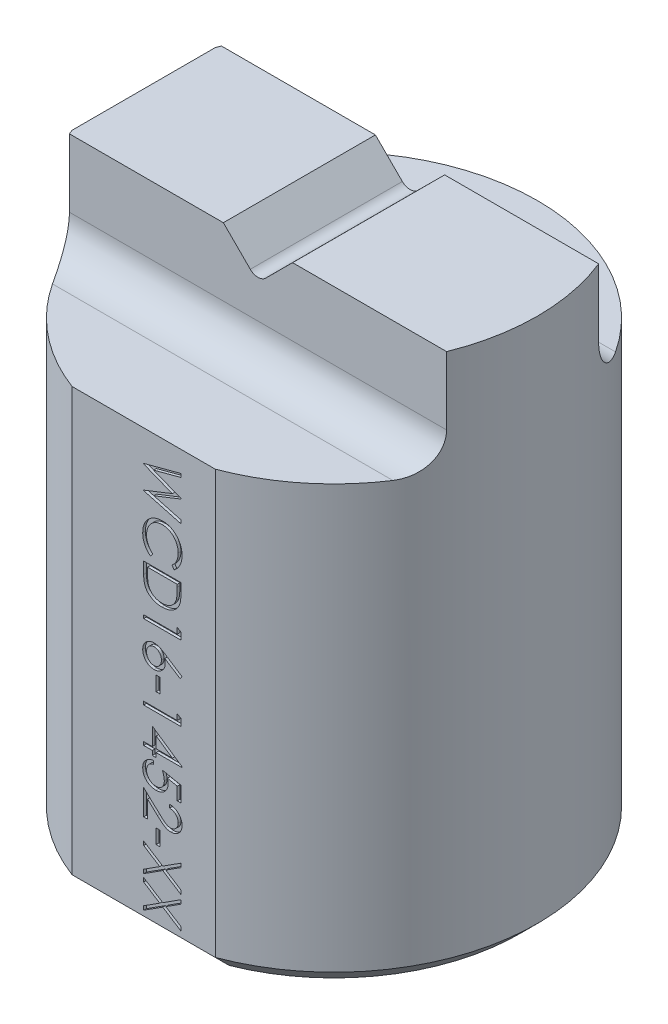
from build123d import *

# Parameters (mm, degrees)
CROQUIS1_R                 = 19.0246
SALIENTE_EXTRUIR1_DEPTH    = 50.8
CORTAR_EXTRUIR5_DEPTH      = 50.8
CORTAR_EXTRUIR5_DEPTH_BACK = 50.8
CORTAR_EXTRUIR7_DEPTH      = 50.8
CORTAR_EXTRUIR7_DEPTH_BACK = 50.8
CORTAR_EXTRUIR4_START      = -50.8
CORTAR_EXTRUIR4_DEPTH      = 50.8
CHAFL_N1_SIZE              = 1.5875
CROQUIS16_W                = 0.358974359
CROQUIS16_H                = 1.346153846
CORTAR_EXTRUIR8_DEPTH      = 0.254


with BuildPart() as part:
    # Croquis1 → Saliente-Extruir1 (new body)
    with BuildSketch(Plane(origin=(0, 0, 0), x_dir=(1, 0, 0), z_dir=(0, 1, 0))):
        with Locations(Location((0, 0, 0), (0, 0, 270))):
            Circle(CROQUIS1_R)
    extrude(amount=SALIENTE_EXTRUIR1_DEPTH)

    # Croquis12 → Cortar-Extruir5 (cut, two sides: drawn at the far end of the back side and taken through both)
    with BuildSketch(Plane(origin=(0, 0, 0), x_dir=(0, 0, -1), z_dir=(1, 0, 0)).offset(-CORTAR_EXTRUIR5_DEPTH_BACK)):
        with BuildLine():
            Line((7.112, 50.8), (19.0246, 50.8))
            Line((19.0246, 50.8), (19.0246, 41.148))
            Line((19.0246, 41.148), (10.414, 41.148))
            ThreePointArc((10.414, 41.148), (8.079133409, 42.115133409), (7.112, 44.45))
            Line((7.112, 44.45), (7.112, 50.8))
        make_face()
        with BuildLine():
            Line((-7.112, 50.8), (-19.0246, 50.8))
            Line((-19.0246, 50.8), (-19.0246, 41.148))
            Line((-19.0246, 41.148), (-10.414, 41.148))
            ThreePointArc((-10.414, 41.148), (-8.079133409, 42.115133409), (-7.112, 44.45))
            Line((-7.112, 44.45), (-7.112, 50.8))
        make_face()
    extrude(amount=CORTAR_EXTRUIR5_DEPTH + CORTAR_EXTRUIR5_DEPTH_BACK, mode=Mode.SUBTRACT)

    # Croquis14 → Cortar-Extruir7 (cut, two sides: drawn at the far end of the back side and taken through both)
    with BuildSketch(Plane.XY.offset(-CORTAR_EXTRUIR7_DEPTH_BACK)):
        with BuildLine():
            Line((-3.2385, 50.8), (-0.717176471, 48.287385732))
            ThreePointArc((-0.717176471, 48.287385732), (0, 47.99104809), (0.717176471, 48.287385732))
            Line((0.717176471, 48.287385732), (3.2385, 50.8))
            Line((3.2385, 50.8), (-3.2385, 50.8))
        make_face()
    extrude(amount=CORTAR_EXTRUIR7_DEPTH + CORTAR_EXTRUIR7_DEPTH_BACK, mode=Mode.SUBTRACT)

    # Croquis11 → Cortar-Extruir4 (cut)
    with BuildSketch(Plane(origin=(0, 50.8, 0), x_dir=(1, 0, 0), z_dir=(0, 1, 0)).offset(CORTAR_EXTRUIR4_START)):
        with BuildLine():
            Line((-17.8054, 0), (-17.8054, 6.700980227))
            ThreePointArc((-17.8054, 6.700980227), (-19.0246, 0), (-17.8054, -6.700980227))
            Line((-17.8054, -6.700980227), (-17.8054, 0))
        make_face()
        with BuildLine():
            Line((0, -17.8054), (-6.700980227, -17.8054))
            ThreePointArc((-6.700980227, -17.8054), (0, -19.0246), (6.700980227, -17.8054))
            Line((6.700980227, -17.8054), (0, -17.8054))
        make_face()
    extrude(amount=CORTAR_EXTRUIR4_DEPTH, mode=Mode.SUBTRACT)

    # Chaflán1
    # the kernel refuses this chamfer: 1.5875 mm, written as the material it takes off along each edge
    with BuildSketch(Plane(origin=(10.78352697, 0, 17.8054), x_dir=(0, 0.9996219169112966, 0.027495876610585654), z_dir=(-1, 0, 0)), Plane(origin=(-17.8054, 0, 10.78352697), x_dir=(-0.027495876610585654, 0.9996219169112966, 0), z_dir=(0, 0, -1))) as chafl_n1_piece_1:
        Polygon((CHAFL_N1_SIZE * 0.999621916911, CHAFL_N1_SIZE * 0.0274958766106), (-CHAFL_N1_SIZE * 0.0274958766106, CHAFL_N1_SIZE * 0.999621916911), (0, 0), align=None)
    extrude(amount=21.56705394, mode=Mode.SUBTRACT)
    with BuildSketch(Plane(origin=(0, 0, 0), x_dir=(0.14429341464634798, 0, 0.9895349465732359), z_dir=(-0.9895349465732359, 0, 0.14429341464634798))) as chafl_n1_piece_2:
        Polygon((19.0246 - CHAFL_N1_SIZE, 0), (19.0246, CHAFL_N1_SIZE), (19.0246, 0), align=None)
    revolve(axis=Axis((0, 0, 0), (0, 1, 0)), revolution_arc=253.40727091, mode=Mode.SUBTRACT)
    with BuildSketch(Plane(origin=(0, 0, 0), x_dir=(-0.9894579755550961, 0, 0.14482028383624634), z_dir=(-0.14482028383624634, 0, -0.9894579755550961))) as chafl_n1_piece_3:
        Polygon((19.0246, CHAFL_N1_SIZE), (19.0246 - CHAFL_N1_SIZE, 0), (19.0246, 0), align=None)
    revolve(axis=Axis((0, 0, 0), (0, 1, 0)), revolution_arc=73.346255269, mode=Mode.SUBTRACT)

    # Croquis16 → Cortar-Extruir8 (cut)
    # profile 1 of 13: a face of its own
    with BuildSketch(Plane.XY.offset(17.8054)):
        Polygon((3.5, 4.666948718), (3.5, 4.30446875), (2.069010417, 3.388803686), (3.5, 2.473839744), (3.5, 2.10925641), (1.78505609, 3.206512019), (0, 2.064384615), (0, 2.426864583), (1.501802885, 3.388102564), (0, 4.348639423), (0, 4.711820513), (1.785757212, 3.569693109), align=None)
    # profile 2 of 13: a face of its own
    with BuildSketch(Plane.XY.offset(17.8054)):
        Polygon((3.5, 7.628487179), (3.5, 7.266007212), (2.069010417, 6.350342147), (3.5, 5.435378205), (3.5, 5.070794872), (1.78505609, 6.168050481), (0, 5.025923077), (0, 5.388403045), (1.501802885, 6.349641026), (0, 7.310177885), (0, 7.673358974), (1.785757212, 6.531231571), align=None)
    # profile 3 of 13: a face of its own
    with BuildSketch(Plane.XY.offset(17.8054)):
        with Locations((1.346153847, 8.638102564)):
            Rectangle(CROQUIS16_W, CROQUIS16_H)
    # profile 4 of 13: a face of its own
    with BuildSketch(Plane.XY.offset(17.8054)):
        with BuildLine():
            Line((2.423076923, 11.554769231), (2.423076923, 11.868871795))
            add(Edge.make_bspline(
                [(2.423076923, 11.868871795), (2.464748016, 11.86682499), (2.546588934, 11.862805121), (2.665909934, 11.843971901), (2.779975252, 11.817048868), (2.887806988, 11.778892651), (2.990693283, 11.731773056), (3.087267925, 11.674085036), (3.178489406, 11.607058407), (3.262630601, 11.53081613), (3.339546174, 11.448086233), (3.406669589, 11.359364397), (3.46273344, 11.265562514), (3.5098564, 11.167494181), (3.545184955, 11.06402521), (3.571409677, 10.956144647), (3.587185182, 10.843364885), (3.588881084, 10.766524949), (3.58974359, 10.727445513)],
                knots=[0, 0, 0, 0, 1.100776268, 2.161895295, 3.184016182, 4.190939212, 5.176500551, 6.166955529, 7.155448256, 8.160289653, 9.16017456, 10.133824356, 11.091467644, 12.04088621, 13.000931625, 13.972173743, 14.968683325, 16, 16, 16, 16], degree=3))
            add(Edge.make_bspline(
                [(3.58974359, 10.727445513), (3.588845133, 10.689067439), (3.587079698, 10.613655894), (3.571918669, 10.50359388), (3.548173078, 10.398816585), (3.514857661, 10.299528819), (3.470073234, 10.206522754), (3.416275695, 10.11909971), (3.354055864, 10.036218899), (3.28080205, 9.961612115), (3.202599666, 9.893104036), (3.119111762, 9.834001781), (3.032882477, 9.783388617), (2.943254275, 9.741200937), (2.849383247, 9.710144798), (2.752636044, 9.68656659), (2.652011233, 9.673239177), (2.583904677, 9.671193753), (2.549278846, 9.670153846)],
                knots=[0, 0, 0, 0, 1.111607364, 2.184268762, 3.212621178, 4.221274766, 5.211760367, 6.196651075, 7.1921475, 8.207485113, 9.220403448, 10.201281604, 11.166441695, 12.114753415, 13.065576456, 14.026450734, 14.996634279, 16, 16, 16, 16], degree=3))
            add(Edge.make_bspline(
                [(2.549278846, 9.670153846), (2.500531028, 9.671844829), (2.403890848, 9.67519712), (2.261657256, 9.703989144), (2.123960365, 9.748782887), (2.012708427, 9.80201516), (1.923621611, 9.856555617), (1.850138441, 9.905614056), (1.771037485, 9.963087935), (1.68655876, 10.029763645), (1.596048281, 10.104277374), (1.499558358, 10.18729928), (1.398086626, 10.279422838), (1.328781019, 10.344081328), (1.29286859, 10.377585737)],
                knots=[0, 0, 0, 0, 1.184136889, 2.347493852, 3.513608722, 4.697895552, 5.335178528, 6.052199267, 6.845488095, 7.711597353, 8.668264519, 9.695616787, 10.805926351, 12, 12, 12, 12], degree=3))
            Line((1.29286859, 10.377585737), (0.358974359, 11.253286859))
            Line((0.358974359, 11.253286859), (0.358974359, 9.625282051))
            Line((0.358974359, 9.625282051), (0, 9.625282051))
            Line((0, 9.625282051), (0, 12.003487179))
            Line((0, 12.003487179), (1.448517628, 10.646115385))
            add(Edge.make_bspline(
                [(1.448517628, 10.646115385), (1.483014053, 10.613065158), (1.549274626, 10.549582437), (1.646042341, 10.459830643), (1.735709677, 10.379089433), (1.818673971, 10.307305249), (1.894464892, 10.244419025), (1.963676397, 10.19063197), (2.025714532, 10.145706354), (2.098594339, 10.098094564), (2.187681869, 10.052693562), (2.296003864, 10.012790727), (2.407759457, 9.988634094), (2.483257707, 9.98572148), (2.521233974, 9.98425641)],
                knots=[0, 0, 0, 0, 1.329530082, 2.553755191, 3.672934919, 4.687409497, 5.60679272, 6.413407421, 7.126401618, 7.737995624, 8.834647426, 9.90044882, 10.943907757, 12, 12, 12, 12], degree=3))
            add(Edge.make_bspline(
                [(2.521233974, 9.98425641), (2.545118012, 9.984885622), (2.592188863, 9.986125678), (2.661156757, 9.997277074), (2.727942288, 10.013660688), (2.7917197, 10.038912898), (2.853743372, 10.069252499), (2.91212759, 10.108013576), (2.968862533, 10.152307309), (3.022002807, 10.203685867), (3.07068755, 10.260089976), (3.113810711, 10.319686161), (3.149850063, 10.38273576), (3.179393496, 10.448976018), (3.202568894, 10.51822145), (3.218627469, 10.590606205), (3.228709954, 10.665930219), (3.230074126, 10.717363715), (3.230769231, 10.743571314)],
                knots=[0, 0, 0, 0, 0.991504627, 1.954065223, 2.895985987, 3.842598665, 4.797835564, 5.759220273, 6.74786863, 7.784730864, 8.824135544, 9.839918996, 10.835834653, 11.835434876, 12.84861661, 13.863796685, 14.911511676, 16, 16, 16, 16], degree=3))
            add(Edge.make_bspline(
                [(3.230769231, 10.743571314), (3.230054415, 10.770942268), (3.228650634, 10.824694303), (3.218824902, 10.903611613), (3.201890229, 10.978903664), (3.178673151, 11.050722869), (3.149442666, 11.119138426), (3.112332364, 11.183531721), (3.068791169, 11.244490644), (3.019156583, 11.301903234), (2.963634417, 11.354656397), (2.902503649, 11.40198027), (2.835366634, 11.442342532), (2.763739792, 11.47812186), (2.685718657, 11.505498341), (2.603193858, 11.528899494), (2.514992916, 11.545898701), (2.454224465, 11.551763277), (2.423076923, 11.554769231)],
                knots=[0, 0, 0, 0, 1.031212865, 2.025131798, 2.990757446, 3.934781266, 4.865570067, 5.788494791, 6.729227313, 7.684356718, 8.643577152, 9.610526866, 10.590658432, 11.59095419, 12.621640561, 13.700587263, 14.82141059, 16, 16, 16, 16], degree=3))
        make_face()
    # profile 5 of 13: a face of its own
    with BuildSketch(Plane.XY.offset(17.8054)):
        with BuildLine():
            Line((3.5, 12.497076923), (3.141025641, 12.497076923))
            Line((3.141025641, 12.497076923), (3.141025641, 13.686880609))
            Line((3.141025641, 13.686880609), (2.220452724, 13.876183494))
            add(Edge.make_bspline(
                [(2.220452724, 13.876183494), (2.230682996, 13.839127619), (2.25050253, 13.767337723), (2.2725083, 13.661377862), (2.285773744, 13.560785659), (2.287585055, 13.495510289), (2.288461538, 13.463923878)],
                knots=[0, 0, 0, 0, 1.100273476, 2.13160584, 3.095893838, 4, 4, 4, 4], degree=3))
            add(Edge.make_bspline(
                [(2.288461538, 13.463923878), (2.287615381, 13.424840273), (2.285951625, 13.347992141), (2.269982922, 13.235551278), (2.244831581, 13.128225344), (2.20975253, 13.026197713), (2.16460626, 12.929248626), (2.108941852, 12.837919492), (2.043144334, 12.751692715), (1.967848539, 12.671708181), (1.884877575, 12.599258758), (1.795958621, 12.535307426), (1.701010796, 12.482120557), (1.600453954, 12.438362922), (1.494456815, 12.403645464), (1.382234792, 12.380474877), (1.264783752, 12.36506331), (1.184479588, 12.363340209), (1.143529647, 12.362461538)],
                knots=[0, 0, 0, 0, 1.052772836, 2.070014431, 3.053871312, 4.019926262, 4.972333346, 5.930471369, 6.896690565, 7.89035727, 8.885779078, 9.861050232, 10.836829716, 11.812751485, 12.812646763, 13.836748493, 14.896881366, 16, 16, 16, 16], degree=3))
            add(Edge.make_bspline(
                [(1.143529647, 12.362461538), (1.11500739, 12.363126524), (1.058348328, 12.364447509), (0.974204676, 12.37116741), (0.891839802, 12.38409824), (0.81125494, 12.401483994), (0.732557826, 12.423959989), (0.655777085, 12.451464292), (0.580676295, 12.483885086), (0.507250538, 12.520488929), (0.437763412, 12.562832793), (0.371142281, 12.607437111), (0.309838941, 12.656846418), (0.251615412, 12.708668561), (0.198758223, 12.764975694), (0.149005388, 12.824020133), (0.104518066, 12.887187505), (0.063599772, 12.953346878), (0.026963122, 13.022456533), (-0.003598389, 13.095217228), (-0.030385817, 13.170031676), (-0.052169495, 13.247566689), (-0.069070481, 13.327672058), (-0.080579823, 13.410623634), (-0.088953871, 13.496005178), (-0.089478555, 13.553880071), (-0.08974359, 13.583114583)],
                knots=[0, 0, 0, 0, 1.05623316, 2.098192244, 3.122504159, 4.140841222, 5.148757784, 6.150489607, 7.158294732, 8.176043417, 9.185147859, 10.169157858, 11.142149047, 12.097904048, 13.0527185, 13.998867679, 14.954465986, 15.910220987, 16.877849176, 17.847023716, 18.829548819, 19.818454515, 20.826519638, 21.858115382, 22.918063636, 24, 24, 24, 24], degree=3))
            add(Edge.make_bspline(
                [(-0.08974359, 13.583114583), (-0.089052691, 13.617988721), (-0.08769343, 13.686599468), (-0.073475808, 13.787120644), (-0.053108741, 13.883833027), (-0.02248395, 13.975971225), (0.015945705, 14.064312609), (0.064206634, 14.147681188), (0.119660638, 14.227715607), (0.184221067, 14.302240627), (0.255448024, 14.371268491), (0.331914473, 14.434008824), (0.413924458, 14.489031719), (0.500779798, 14.536561723), (0.592629943, 14.577045569), (0.689749741, 14.608864467), (0.791650622, 14.634541751), (0.861804012, 14.645405319), (0.897435897, 14.650923077)],
                knots=[0, 0, 0, 0, 1.046825758, 2.059506013, 3.044032586, 4.011925612, 4.970610144, 5.93275819, 6.900651216, 7.891265644, 8.889116719, 9.876966323, 10.858259055, 11.851035124, 12.847502422, 13.86866322, 14.9174643, 16, 16, 16, 16], degree=3))
            Line((0.897435897, 14.650923077), (0.897435897, 14.336820513))
            add(Edge.make_bspline(
                [(0.897435897, 14.336820513), (0.864056261, 14.329096819), (0.799898745, 14.314251452), (0.709809781, 14.281580974), (0.629226092, 14.241881547), (0.5580716, 14.193600698), (0.495697109, 14.137172103), (0.439632625, 14.073243352), (0.389723386, 14.000903697), (0.34785381, 13.920549253), (0.312197898, 13.835725533), (0.288442785, 13.746961156), (0.271742785, 13.656656069), (0.270070904, 13.595577798), (0.269230769, 13.564885417)],
                knots=[0, 0, 0, 0, 1.136389429, 2.184203582, 3.172920998, 4.111012962, 5.028380909, 5.957351669, 6.927793475, 7.937618031, 8.960409703, 9.974842029, 10.982339866, 12, 12, 12, 12], degree=3))
            add(Edge.make_bspline(
                [(0.269230769, 13.564885417), (0.270051547, 13.534926972), (0.271667666, 13.47593855), (0.284106678, 13.389127163), (0.303264249, 13.305314289), (0.331934104, 13.225326932), (0.366778822, 13.147765393), (0.411493898, 13.074591622), (0.462953917, 13.003688745), (0.521910547, 12.937260612), (0.586880241, 12.876421162), (0.656357635, 12.822665041), (0.730474481, 12.777888128), (0.807947634, 12.740154019), (0.889626191, 12.71150072), (0.975127366, 12.691059739), (1.064662347, 12.67905668), (1.125731656, 12.6774055), (1.156850962, 12.676564103)],
                knots=[0, 0, 0, 0, 1.027316725, 2.022795036, 3.002884548, 3.971462791, 4.93288096, 5.914575861, 6.907176829, 7.935150275, 8.956128384, 9.956726525, 10.942570165, 11.921478529, 12.907843606, 13.90538589, 14.932640048, 16, 16, 16, 16], degree=3))
            add(Edge.make_bspline(
                [(1.156850962, 12.676564103), (1.18494363, 12.677116522), (1.239962545, 12.678198425), (1.320101712, 12.690221023), (1.396479006, 12.707062818), (1.468411408, 12.732921244), (1.536952265, 12.764871524), (1.600634552, 12.805406609), (1.661094376, 12.851742387), (1.715875584, 12.906014398), (1.766777344, 12.96519572), (1.810106091, 13.03066015), (1.846574147, 13.100914496), (1.878041003, 13.175145636), (1.900642067, 13.255110105), (1.917609863, 13.339226858), (1.927425251, 13.428403533), (1.928787135, 13.489374225), (1.929487179, 13.520714744)],
                knots=[0, 0, 0, 0, 1.045726679, 2.048034203, 3.01323695, 3.95502507, 4.889743367, 5.8246644, 6.761650845, 7.722168973, 8.692072792, 9.66525385, 10.638902184, 11.638179751, 12.663148338, 13.728659964, 14.832472288, 16, 16, 16, 16], degree=3))
            add(Edge.make_bspline(
                [(1.929487179, 13.520714744), (1.928926304, 13.548079266), (1.927778104, 13.604098693), (1.918742011, 13.690228466), (1.904840851, 13.780344066), (1.884804843, 13.874795351), (1.859718381, 13.973323116), (1.828388536, 14.076091213), (1.792300505, 14.183102126), (1.764309399, 14.255128133), (1.75, 14.291948718)],
                knots=[0, 0, 0, 0, 0.824638674, 1.688163388, 2.607705698, 3.571998603, 4.597075385, 5.671199175, 6.809488238, 8, 8, 8, 8], degree=3))
            Line((1.75, 14.291948718), (3.5, 13.932974359))
            Line((3.5, 13.932974359), (3.5, 12.497076923))
        make_face()
    # profile 6 of 13: a face of its own
    with BuildSketch(Plane.XY.offset(17.8054)):
        Polygon((3.58974359, 15.477545673), (3.58974359, 15.41374359), (1.166666667, 15.41374359), (1.166666667, 15.009897436), (0.807692308, 15.009897436), (0.807692308, 15.41374359), (0, 15.41374359), (0, 15.727846154), (0.807692308, 15.727846154), (0.807692308, 17.388102564), align=None)
        Polygon((1.166666667, 15.727846154), (2.685296474, 15.727846154), (1.166666667, 16.770414263), align=None, mode=Mode.SUBTRACT)
    # profile 7 of 13: a face of its own
    with BuildSketch(Plane.XY.offset(17.8054)):
        Polygon((3.5, 19.336520032), (3.5, 18.689384615), (0, 18.689384615), (0, 19.003487179), (3.141025641, 19.003487179), (3.141025641, 19.541948718), align=None)
    # profile 8 of 13: a face of its own
    with BuildSketch(Plane.XY.offset(17.8054)):
        with Locations((1.346153847, 21.022717949)):
            Rectangle(CROQUIS16_W, CROQUIS16_H)
    # profile 9 of 13: a face of its own
    with BuildSketch(Plane.XY.offset(17.8054)):
        with BuildLine():
            Line((3.58974359, 22.772717949), (3.399739583, 22.530129808))
            Line((3.399739583, 22.530129808), (1.985576923, 23.454909455))
            add(Edge.make_bspline(
                [(1.985576923, 23.454909455), (1.995390784, 23.393339178), (2.014533829, 23.273239391), (2.017691774, 23.151673493), (2.019230769, 23.092429487)],
                knots=[0, 0, 0, 0, 1.025318673, 2, 2, 2, 2], degree=3))
            add(Edge.make_bspline(
                [(2.019230769, 23.092429487), (2.018288505, 23.056855201), (2.016439821, 22.987059892), (2.001830242, 22.884505458), (1.979090511, 22.785938065), (1.945809534, 22.691577603), (1.903309502, 22.601304315), (1.852370002, 22.514602002), (1.790364494, 22.433099969), (1.721099491, 22.355748796), (1.644382519, 22.285521697), (1.562981179, 22.223345642), (1.476980299, 22.17111885), (1.386423433, 22.128744928), (1.291450173, 22.09584005), (1.192182034, 22.071852405), (1.088550562, 22.057672812), (1.018072387, 22.055747321), (0.982271635, 22.054769231)],
                knots=[0, 0, 0, 0, 1.044136307, 2.048553127, 3.035567123, 4.010001674, 4.980053131, 5.96154148, 6.956538004, 7.981742224, 9.006487041, 10.005615874, 10.984750588, 11.954802044, 12.935714515, 13.930994945, 14.949008866, 16, 16, 16, 16], degree=3))
            add(Edge.make_bspline(
                [(0.982271635, 22.054769231), (0.933321047, 22.056595759), (0.83705467, 22.060187816), (0.696257255, 22.086336465), (0.563199166, 22.131463191), (0.437357507, 22.191837339), (0.322393647, 22.270168048), (0.218497146, 22.362994245), (0.127936082, 22.471193397), (0.050247518, 22.592203324), (-0.011475948, 22.723173645), (-0.057109366, 22.860500311), (-0.084376494, 23.003009528), (-0.087946329, 23.099792894), (-0.08974359, 23.148519231)],
                knots=[0, 0, 0, 0, 1.031881447, 2.029301251, 3.006342947, 3.987068354, 4.962916383, 5.929513747, 6.915671209, 7.928552063, 8.953527267, 9.960179832, 10.973036711, 12, 12, 12, 12], degree=3))
            add(Edge.make_bspline(
                [(-0.08974359, 23.148519231), (-0.088215388, 23.195615941), (-0.085188287, 23.288906276), (-0.058222293, 23.426138938), (-0.014515404, 23.558002458), (0.045699679, 23.683569946), (0.12175457, 23.7998976), (0.213327878, 23.903937278), (0.318395727, 23.995327004), (0.437280428, 24.070981528), (0.56420709, 24.13264017), (0.697761511, 24.176128902), (0.835255853, 24.204253179), (0.928849864, 24.207154812), (0.975961538, 24.208615385)],
                knots=[0, 0, 0, 0, 1.011913813, 2.004424092, 2.994488568, 3.992479987, 4.990471406, 5.973328987, 6.963763268, 7.974390938, 8.994854117, 9.989689954, 10.988086187, 12, 12, 12, 12], degree=3))
            add(Edge.make_bspline(
                [(0.975961538, 24.208615385), (1.011992998, 24.207346936), (1.085529615, 24.20475816), (1.197225054, 24.189308639), (1.311065619, 24.160972332), (1.407571272, 24.130306253), (1.487495437, 24.099876247), (1.550609439, 24.071660844), (1.617259852, 24.040112586), (1.686185585, 24.003133635), (1.759355993, 23.963932962), (1.834061355, 23.918142127), (1.913030141, 23.870358688), (1.965606332, 23.835353759), (1.992588141, 23.817389423)],
                knots=[0, 0, 0, 0, 1.17367173, 2.395347028, 3.66355231, 4.98980831, 5.690886799, 6.447442954, 7.240630024, 8.091733897, 8.994365608, 9.943299771, 10.944512865, 12, 12, 12, 12], degree=3))
            Line((1.992588141, 23.817389423), (3.58974359, 22.772717949))
        make_face()
        with BuildLine():
            add(Edge.make_bspline(
                [(1.66025641, 23.158334936), (1.659468059, 23.184996342), (1.657921319, 23.237305803), (1.649185356, 23.313954558), (1.632633, 23.38630165), (1.611222464, 23.455173907), (1.582069354, 23.519851671), (1.547081535, 23.581079486), (1.505467755, 23.638224697), (1.457762962, 23.690377722), (1.405981035, 23.738091502), (1.350942584, 23.780095357), (1.292870682, 23.815504814), (1.232264974, 23.84443574), (1.168808743, 23.866912627), (1.102852139, 23.883184462), (1.033937119, 23.892237247), (0.987204715, 23.893743612), (0.963341346, 23.894512821)],
                knots=[0, 0, 0, 0, 1.129054775, 2.21519617, 3.259426851, 4.267013074, 5.263608451, 6.256463875, 7.247987236, 8.249677815, 9.244060445, 10.225610515, 11.175892485, 12.118571871, 13.063688666, 14.021206195, 14.989551517, 16, 16, 16, 16], degree=3))
            add(Edge.make_bspline(
                [(0.963341346, 23.894512821), (0.939692266, 23.893884845), (0.893319942, 23.892653479), (0.824967916, 23.88152419), (0.759251192, 23.864402723), (0.696121704, 23.839341431), (0.635923815, 23.807907244), (0.578229919, 23.769224011), (0.523000197, 23.723946732), (0.471627345, 23.671312794), (0.424506917, 23.614552194), (0.382550799, 23.554524101), (0.347318879, 23.491419379), (0.31946527, 23.424877948), (0.296652499, 23.35583144), (0.280587851, 23.283753121), (0.271508182, 23.208579661), (0.269999871, 23.157657806), (0.269230769, 23.131692308)],
                knots=[0, 0, 0, 0, 0.989642335, 1.94054129, 2.892446913, 3.828371744, 4.778262963, 5.730973156, 6.732161388, 7.763274768, 8.805796303, 9.818398792, 10.825975928, 11.825728216, 12.834635236, 13.867465554, 14.912602056, 16, 16, 16, 16], degree=3))
            add(Edge.make_bspline(
                [(0.269230769, 23.131692308), (0.26999981, 23.105726767), (0.271508004, 23.054804829), (0.28058853, 22.979631973), (0.296650009, 22.907551419), (0.319474296, 22.838513035), (0.347285394, 22.771941613), (0.382771567, 22.708781653), (0.424251821, 22.648180451), (0.471708445, 22.591457088), (0.522709916, 22.538603154), (0.578729986, 22.494386368), (0.635465272, 22.454481044), (0.69636159, 22.424254156), (0.759213189, 22.39891376), (0.824978097, 22.381878678), (0.893317277, 22.370726358), (0.939691366, 22.369498156), (0.963341346, 22.368871795)],
                knots=[0, 0, 0, 0, 1.087205562, 2.132157158, 3.164804748, 4.173533273, 5.173108684, 6.180507559, 7.20098426, 8.243321352, 9.274252308, 10.269075238, 11.227079059, 12.172305571, 13.108064818, 14.05980203, 15.010532752, 16, 16, 16, 16], degree=3))
            add(Edge.make_bspline(
                [(0.963341346, 22.368871795), (0.987238671, 22.369415674), (1.034141346, 22.370483132), (1.102789445, 22.382790474), (1.169347332, 22.399413587), (1.232315684, 22.426278062), (1.293435829, 22.458275844), (1.350960907, 22.499038917), (1.406520615, 22.545774777), (1.458069581, 22.599899439), (1.505220459, 22.658782225), (1.546839016, 22.721399777), (1.58196424, 22.786907234), (1.611271333, 22.855241312), (1.632420594, 22.927184165), (1.649074723, 23.001574486), (1.657906821, 23.079131391), (1.659465487, 23.131673307), (1.66025641, 23.158334936)],
                knots=[0, 0, 0, 0, 0.978850575, 1.921165339, 2.853482305, 3.786193361, 4.721019802, 5.678231452, 6.671107257, 7.694736563, 8.738100728, 9.761595396, 10.773671158, 11.783065439, 12.804898115, 13.84455739, 14.906252091, 16, 16, 16, 16], degree=3))
        make_face(mode=Mode.SUBTRACT)
    # profile 10 of 13: a face of its own
    with BuildSketch(Plane.XY.offset(17.8054)):
        Polygon((3.5, 26.336520032), (3.5, 25.689384615), (0, 25.689384615), (0, 26.003487179), (3.141025641, 26.003487179), (3.141025641, 26.541948718), align=None)
    # profile 11 of 13: a face of its own
    with BuildSketch(Plane.XY.offset(17.8054)):
        with BuildLine():
            Line((0, 30.356051282), (3.5, 30.356051282))
            Line((3.5, 30.356051282), (3.5, 29.649320513))
            add(Edge.make_bspline(
                [(3.5, 29.649320513), (3.499558636, 29.587851397), (3.498705923, 29.469093385), (3.493268378, 29.297482649), (3.483746477, 29.138925357), (3.469609165, 28.993511552), (3.452640429, 28.861007616), (3.431060433, 28.741625767), (3.405680896, 28.635172539), (3.384034427, 28.569703226), (3.373798077, 28.53874359)],
                knots=[0, 0, 0, 0, 1.314317071, 2.539253741, 3.67075822, 4.709970291, 5.662644612, 6.526156501, 7.303037452, 8, 8, 8, 8], degree=3))
            add(Edge.make_bspline(
                [(3.373798077, 28.53874359), (3.358367354, 28.498248876), (3.327855826, 28.418177735), (3.270299776, 28.304170239), (3.205085737, 28.196846265), (3.132133327, 28.095622001), (3.049356095, 28.002840279), (2.960347486, 27.914760501), (2.861470361, 27.835336639), (2.756081895, 27.761381368), (2.643112969, 27.696669297), (2.524856338, 27.639600767), (2.401533274, 27.590874206), (2.272246166, 27.552854069), (2.138236163, 27.521442961), (1.998488812, 27.500366855), (1.853818803, 27.486366851), (1.755643076, 27.484966792), (1.705829327, 27.48425641)],
                knots=[0, 0, 0, 0, 0.98467389, 1.947018643, 2.898343565, 3.837828625, 4.779009928, 5.722093987, 6.681368302, 7.658573986, 8.646467994, 9.637429229, 10.641859304, 11.657149908, 12.698561448, 13.768651538, 14.867827761, 16, 16, 16, 16], degree=3))
            add(Edge.make_bspline(
                [(1.705829327, 27.48425641), (1.662568235, 27.484885802), (1.577317734, 27.486126083), (1.451674744, 27.497249332), (1.329768825, 27.513447821), (1.212135374, 27.538411621), (1.097981959, 27.569086111), (0.987850679, 27.606947891), (0.881660811, 27.651817765), (0.780277346, 27.703875831), (0.683868003, 27.760799015), (0.594091818, 27.823211956), (0.509241366, 27.887533188), (0.433143845, 27.958722291), (0.361446986, 28.031873544), (0.298024701, 28.110866017), (0.240114366, 28.193126183), (0.188138683, 28.2802385), (0.143044021, 28.374290919), (0.104412226, 28.47656713), (0.072602821, 28.587614895), (0.04602105, 28.707264004), (0.024946939, 28.835748905), (0.010819612, 28.973187454), (0.001266947, 29.119370863), (0.000430516, 29.219750112), (0, 29.271415865)],
                knots=[0, 0, 0, 0, 1.105818345, 2.179130549, 3.222742436, 4.24813173, 5.251184997, 6.243232575, 7.223185975, 8.195898781, 9.155064964, 10.083206407, 10.990357329, 11.874224667, 12.744762365, 13.607037788, 14.46074101, 15.315384698, 16.197310979, 17.123950979, 18.107232398, 19.148086642, 20.256146639, 21.433991621, 22.679261309, 24, 24, 24, 24], degree=3))
            Line((0, 29.271415865), (0, 30.356051282))
        make_face()
        with BuildLine():
            Line((0.358974359, 30.041948718), (0.358974359, 29.640205929))
            add(Edge.make_bspline(
                [(0.358974359, 29.640205929), (0.359222455, 29.582477559), (0.359699636, 29.47144476), (0.363886839, 29.311786763), (0.370728776, 29.165907367), (0.380303854, 29.033785857), (0.392972469, 28.915496833), (0.407097372, 28.810793083), (0.424694823, 28.720017825), (0.440645782, 28.665088388), (0.448016827, 28.639705128)],
                knots=[0, 0, 0, 0, 1.375205317, 2.645023457, 3.804390687, 4.853969522, 5.800190428, 6.637939096, 7.370582563, 8, 8, 8, 8], degree=3))
            add(Edge.make_bspline(
                [(0.448016827, 28.639705128), (0.459267547, 28.607756091), (0.481500263, 28.544621117), (0.522070049, 28.453749801), (0.570067383, 28.368956755), (0.623734571, 28.288827338), (0.683902764, 28.213880417), (0.750754071, 28.144448473), (0.823549172, 28.080038028), (0.90256076, 28.021353669), (0.987278009, 27.968916104), (1.076622395, 27.923210955), (1.170378287, 27.884430811), (1.268883606, 27.852896951), (1.372045499, 27.828460022), (1.47959257, 27.811073435), (1.59155837, 27.80026474), (1.667710145, 27.799002456), (1.706530449, 27.798358974)],
                knots=[0, 0, 0, 0, 0.998463025, 1.973077781, 2.929496817, 3.867873318, 4.813809365, 5.759268434, 6.706333209, 7.676553387, 8.657505312, 9.640584699, 10.632319813, 11.645628493, 12.686877747, 13.755137172, 14.855624085, 16, 16, 16, 16], degree=3))
            add(Edge.make_bspline(
                [(1.706530449, 27.798358974), (1.747463684, 27.798872809), (1.827877387, 27.799882241), (1.945871557, 27.812548796), (2.059339618, 27.831098453), (2.168363263, 27.857780687), (2.27280065, 27.892251833), (2.373241804, 27.933499353), (2.468394145, 27.983580318), (2.559063575, 28.040277264), (2.643876965, 28.10392997), (2.721840679, 28.174256075), (2.793099946, 28.250514032), (2.857768222, 28.332352393), (2.91469547, 28.420915395), (2.965337062, 28.514704379), (3.00836517, 28.615040488), (3.031242353, 28.684854498), (3.04286859, 28.720334135)],
                knots=[0, 0, 0, 0, 1.122272916, 2.204715076, 3.251197285, 4.274229216, 5.279697671, 6.265416158, 7.248880903, 8.225321784, 9.195852973, 10.153576302, 11.101466393, 12.055578741, 13.010401466, 13.985536859, 14.976245305, 16, 16, 16, 16], degree=3))
            add(Edge.make_bspline(
                [(3.04286859, 28.720334135), (3.050985018, 28.749685281), (3.06824277, 28.812093871), (3.087068143, 28.913933335), (3.103672642, 29.028548485), (3.117730681, 29.156448186), (3.127818002, 29.297486645), (3.135389317, 29.451772333), (3.140495949, 29.619371937), (3.140844657, 29.735554471), (3.141025641, 29.795854968)],
                knots=[0, 0, 0, 0, 0.674548936, 1.434276114, 2.292660221, 3.240891867, 4.284742987, 5.42552168, 6.663806718, 8, 8, 8, 8], degree=3))
            Line((3.141025641, 29.795854968), (3.141025641, 30.041948718))
            Line((3.141025641, 30.041948718), (0.358974359, 30.041948718))
        make_face(mode=Mode.SUBTRACT)
    # profile 12 of 13: a face of its own
    with BuildSketch(Plane.XY.offset(17.8054)):
        with BuildLine():
            Line((2.857772436, 31.074), (2.647435897, 31.348839744))
            add(Edge.make_bspline(
                [(2.647435897, 31.348839744), (2.670801867, 31.368445632), (2.717218783, 31.407393079), (2.782398327, 31.470052281), (2.843463589, 31.535353924), (2.900705469, 31.603273045), (2.952122234, 31.675032165), (3.000393337, 31.748892964), (3.043661075, 31.826091009), (3.096124061, 31.932842743), (3.150870216, 32.072490592), (3.196773448, 32.248285431), (3.225994623, 32.431796529), (3.229159465, 32.556994129), (3.230769231, 32.620674679)],
                knots=[0, 0, 0, 0, 0.757959112, 1.505699292, 2.245454638, 2.979532153, 3.711538275, 4.438200793, 5.171680507, 5.909471876, 7.393775596, 8.890124382, 10.418191784, 12, 12, 12, 12], degree=3))
            add(Edge.make_bspline(
                [(3.230769231, 32.620674679), (3.230363445, 32.655757552), (3.229555641, 32.725597696), (3.218973416, 32.829252463), (3.20392868, 32.931167996), (3.1821483, 33.030965307), (3.153792222, 33.128446244), (3.120538112, 33.224353044), (3.079156746, 33.317556181), (3.033456552, 33.40917733), (2.981823731, 33.496952488), (2.925523467, 33.580020465), (2.865108338, 33.658001763), (2.800734294, 33.73111247), (2.731601295, 33.798550768), (2.658522608, 33.861397458), (2.580618642, 33.918519893), (2.499350418, 33.971321758), (2.41459849, 34.018305975), (2.326896016, 34.05887912), (2.236578315, 34.09365368), (2.143460367, 34.121425031), (2.047908611, 34.14333003), (1.949720267, 34.158462999), (1.849085923, 34.168950027), (1.780876701, 34.169750401), (1.746494391, 34.170153846)],
                knots=[0, 0, 0, 0, 1.055000685, 2.100209969, 3.131349012, 4.153242145, 5.170189196, 6.184191144, 7.204341339, 8.235672124, 9.263040994, 10.265373269, 11.252624173, 12.22887325, 13.193405896, 14.155809299, 15.126090485, 16.097288279, 17.069732292, 18.038585918, 19.002221264, 19.978698174, 20.959418239, 21.948869816, 22.966084182, 24, 24, 24, 24], degree=3))
            add(Edge.make_bspline(
                [(1.746494391, 34.170153846), (1.694763071, 34.168892027), (1.593195486, 34.166414613), (1.444424876, 34.144366279), (1.301904202, 34.110861187), (1.16652436, 34.060645611), (1.036616002, 33.99872656), (0.914377148, 33.920485948), (0.797960584, 33.829869411), (0.690117636, 33.725594992), (0.591603911, 33.611189176), (0.504853329, 33.488441264), (0.432538447, 33.357656976), (0.3723625, 33.220280346), (0.326105772, 33.075254232), (0.293541649, 32.92283943), (0.272299468, 32.763367435), (0.27026578, 32.654398035), (0.269230769, 32.598939904)],
                knots=[0, 0, 0, 0, 1.029171465, 2.020641659, 2.987623507, 3.938342917, 4.889210282, 5.84687017, 6.821220943, 7.821438502, 8.827599549, 9.822697543, 10.807740252, 11.797342354, 12.80366471, 13.83203677, 14.896651826, 16, 16, 16, 16], degree=3))
            add(Edge.make_bspline(
                [(0.269230769, 32.598939904), (0.270919549, 32.537837215), (0.274243472, 32.417572506), (0.302402721, 32.24120448), (0.348060638, 32.072368714), (0.411958561, 31.911056127), (0.495023849, 31.757721481), (0.595721726, 31.612124821), (0.715010059, 31.47414325), (0.806093187, 31.391171968), (0.852564103, 31.348839744)],
                knots=[0, 0, 0, 0, 1.028121516, 2.023589091, 2.998037872, 3.967518031, 4.937445131, 5.927275754, 6.942489185, 8, 8, 8, 8], degree=3))
            Line((0.852564103, 31.348839744), (0.644330929, 31.074))
            add(Edge.make_bspline(
                [(0.644330929, 31.074), (0.615792429, 31.096118081), (0.558852125, 31.140248297), (0.478581139, 31.21170675), (0.403074401, 31.28698242), (0.332956835, 31.366644183), (0.266764666, 31.449739281), (0.206716932, 31.537731395), (0.150984484, 31.629100729), (0.100628049, 31.724379249), (0.05547798, 31.823254144), (0.017361042, 31.925622515), (-0.015946051, 32.030617092), (-0.04316627, 32.138290751), (-0.064445988, 32.2490032), (-0.078663293, 32.362374582), (-0.088405847, 32.478644212), (-0.089293675, 32.557085667), (-0.08974359, 32.596836538)],
                knots=[0, 0, 0, 0, 0.986756325, 1.968786143, 2.935506311, 3.899499537, 4.868307269, 5.8376204, 6.809456583, 7.792545619, 8.781780509, 9.778496008, 10.776623214, 11.79151764, 12.812666265, 13.856269958, 14.913646641, 16, 16, 16, 16], degree=3))
            add(Edge.make_bspline(
                [(-0.08974359, 32.596836538), (-0.089481597, 32.634480206), (-0.088963539, 32.708915896), (-0.080571372, 32.818814647), (-0.069121635, 32.925804228), (-0.051881504, 33.029578854), (-0.031537164, 33.130704829), (-0.004265907, 33.228265413), (0.026283259, 33.323220624), (0.062188246, 33.415188964), (0.102704429, 33.504248664), (0.148495987, 33.590112476), (0.199177852, 33.672740908), (0.253632863, 33.752946329), (0.313610164, 33.829543913), (0.378276799, 33.903197438), (0.44741481, 33.974319914), (0.497269663, 34.018322599), (0.522335737, 34.040446314)],
                knots=[0, 0, 0, 0, 1.114604814, 2.203992996, 3.262667896, 4.300477797, 5.318619304, 6.316056647, 7.298880507, 8.271930387, 9.238335007, 10.195173496, 11.151986948, 12.108099108, 13.064862484, 14.031167946, 15.010108607, 16, 16, 16, 16], degree=3))
            add(Edge.make_bspline(
                [(0.522335737, 34.040446314), (0.565876926, 34.075881958), (0.652433637, 34.146325434), (0.792719618, 34.236451118), (0.939187827, 34.313598673), (1.092607755, 34.375974594), (1.252635143, 34.424737327), (1.419350657, 34.458518522), (1.592598599, 34.480470127), (1.710435388, 34.482980415), (1.770332532, 34.48425641)],
                knots=[0, 0, 0, 0, 0.994628077, 1.977248131, 2.950237994, 3.925870899, 4.908910175, 5.911660606, 6.938484602, 8, 8, 8, 8], degree=3))
            add(Edge.make_bspline(
                [(1.770332532, 34.48425641), (1.833285352, 34.482694261), (1.957141094, 34.479620829), (2.138952641, 34.453724314), (2.312890308, 34.411559784), (2.479623367, 34.353498946), (2.638197835, 34.276901176), (2.789283438, 34.184173381), (2.93275681, 34.074409835), (3.066783632, 33.948989062), (3.18931972, 33.811414479), (3.297126777, 33.66409756), (3.386844068, 33.507315114), (3.461840291, 33.342797396), (3.519484737, 33.169311678), (3.559837929, 32.987228319), (3.584955044, 32.796889401), (3.588130252, 32.667026976), (3.58974359, 32.601043269)],
                knots=[0, 0, 0, 0, 1.032901378, 2.032168977, 3.007206631, 3.966850309, 4.924221947, 5.891988639, 6.871730993, 7.884084801, 8.900290346, 9.89161143, 10.874607481, 11.860025555, 12.854717796, 13.869097222, 14.917278314, 16, 16, 16, 16], degree=3))
            add(Edge.make_bspline(
                [(3.58974359, 32.601043269), (3.589261812, 32.560828718), (3.588308181, 32.481228065), (3.578996816, 32.363476555), (3.563502411, 32.248830029), (3.542274027, 32.137011231), (3.516255146, 32.027614682), (3.482194419, 31.92176271), (3.442641565, 31.81887891), (3.39824916, 31.718886229), (3.347498469, 31.622872557), (3.292377899, 31.530855366), (3.231615083, 31.443944676), (3.167218841, 31.360505691), (3.096780331, 31.282416887), (3.022593437, 31.207448067), (2.942456775, 31.138188935), (2.886052222, 31.095435479), (2.857772436, 31.074)],
                knots=[0, 0, 0, 0, 1.096705196, 2.170817488, 3.219277236, 4.250701065, 5.274195539, 6.284202015, 7.28098643, 8.279664616, 9.266225751, 10.241373748, 11.203306326, 12.157093976, 13.114198862, 14.069774147, 15.032234603, 16, 16, 16, 16], degree=3))
        make_face()
    # profile 13 of 13: a face of its own
    with BuildSketch(Plane.XY.offset(17.8054)):
        Polygon((3.5, 39.195794872), (3.5, 38.871876603), (0.931089744, 38.186179487), (3.5, 37.168150641), (3.5, 37.122577724), (0.950721154, 36.122076923), (3.5, 35.433575321), (3.5, 35.112461538), (0, 36.056171474), (0, 36.101043269), (2.675480769, 37.154128205), (0, 38.21843109), (0, 38.264004006), align=None)
    extrude(amount=-CORTAR_EXTRUIR8_DEPTH, mode=Mode.SUBTRACT)


solid = part.part
